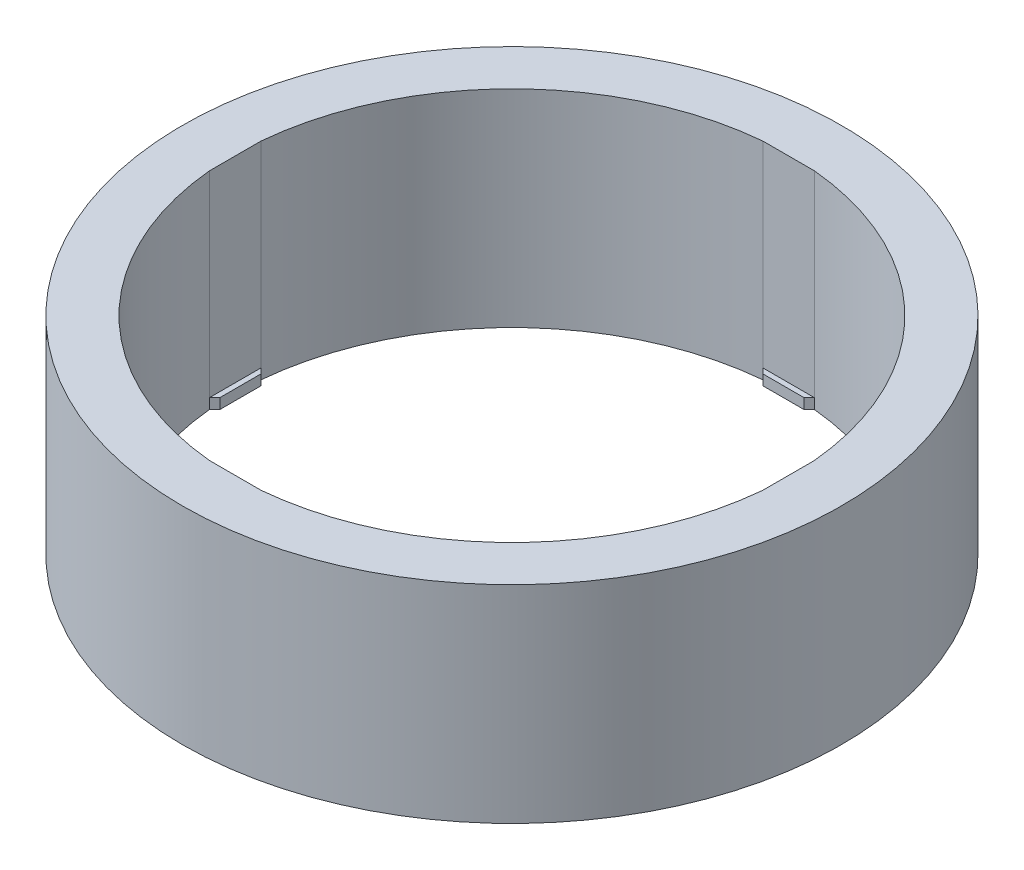
from build123d import *

# Parameters (mm, degrees)
SKETCH1_R           = 12.75
BOSS_EXTRUDE1_DEPTH = 8
SKETCH2_W           = 2
SKETCH2_H           = 0.4
BOSS_EXTRUDE2_DEPTH = 0.2
SKETCH3_W           = 2
SKETCH3_H           = 0.4
BOSS_EXTRUDE3_DEPTH = 0.2
SKETCH4_W           = 2
SKETCH4_H           = 0.4
BOSS_EXTRUDE4_DEPTH = 0.2
CHAMFER1_SIZE       = 0.2
SKETCH5_W           = 2
SKETCH5_H           = 0.4
BOSS_EXTRUDE5_DEPTH = 0.2
CHAMFER2_SIZE       = 0.2


with BuildPart() as part:
    # Sketch1 → Boss-Extrude1 (new body)
    with BuildSketch(Plane(origin=(0, 0, 0), x_dir=(1, 0, 0), z_dir=(0, 1, 0))):
        with Locations(Location((0, 0, 0), (0, 0, 270))):
            Circle(SKETCH1_R)
        with BuildLine():
            Line((-1, 10.703387314), (1, 10.703387314))
            ThreePointArc((1, 10.703387314), (7.601397898, 7.601397898), (10.703387314, 1))
            Line((10.703387314, 1), (10.703387314, -1))
            ThreePointArc((10.703387314, -1), (7.601397898, -7.601397898), (1, -10.703387314))
            Line((1, -10.703387314), (-1, -10.703387314))
            ThreePointArc((-1, -10.703387314), (-7.601397898, -7.601397898), (-10.703387314, -1))
            Line((-10.703387314, -1), (-10.703387314, 1))
            ThreePointArc((-10.703387314, 1), (-7.601397898, 7.601397898), (-1, 10.703387314))
        make_face(mode=Mode.SUBTRACT)
    extrude(amount=BOSS_EXTRUDE1_DEPTH)

    # Sketch2 → Boss-Extrude2 (add)
    with BuildSketch(Plane.XY.offset(-10.703387314)):
        with Locations((0, 0.2)):
            Rectangle(SKETCH2_W, SKETCH2_H)
    extrude(amount=BOSS_EXTRUDE2_DEPTH)

    # Sketch3 → Boss-Extrude3 (add)
    with BuildSketch(Plane(origin=(-10.703387314, 0, 0), x_dir=(0, 0, -1), z_dir=(1, 0, 0))):
        with Locations((0, 0.2)):
            Rectangle(SKETCH3_W, SKETCH3_H)
    extrude(amount=BOSS_EXTRUDE3_DEPTH)

    # Sketch4 → Boss-Extrude4 (add)
    with BuildSketch(Plane(origin=(0, 0, 10.703387314), x_dir=(-1, 0, 0), z_dir=(0, 0, -1))):
        with Locations((0, 0.2)):
            Rectangle(SKETCH4_W, SKETCH4_H)
    extrude(amount=BOSS_EXTRUDE4_DEPTH)

    # Chamfer1
    chamfer1_edges = [part.edges().sort_by_distance(p)[0] for p in [
        (1, 0.2, -10.503387314),
        (-1, 0.2, -10.503387314),
        (-10.503387314, 0.2, 1),
        (-10.503387314, 0.2, -1),
        (-1, 0.2, 10.503387314),
        (1, 0.2, 10.503387314),
    ]]
    chamfer(chamfer1_edges, length=CHAMFER1_SIZE - 0.0001)  # a hair under: the kernel refuses the full size

    # Sketch5 → Boss-Extrude5 (add)
    with BuildSketch(Plane.ZY.offset(-10.703387314)):
        with Locations((0, 0.2)):
            Rectangle(SKETCH5_W, SKETCH5_H)
    extrude(amount=BOSS_EXTRUDE5_DEPTH)

    # Chamfer2
    chamfer2_edges = [part.edges().sort_by_distance(p)[0] for p in [
        (10.503387314, 0.2, 1),
        (10.503387314, 0.2, -1),
    ]]
    chamfer(chamfer2_edges, length=CHAMFER2_SIZE - 0.0001)  # a hair under: the kernel refuses the full size


solid = part.part
